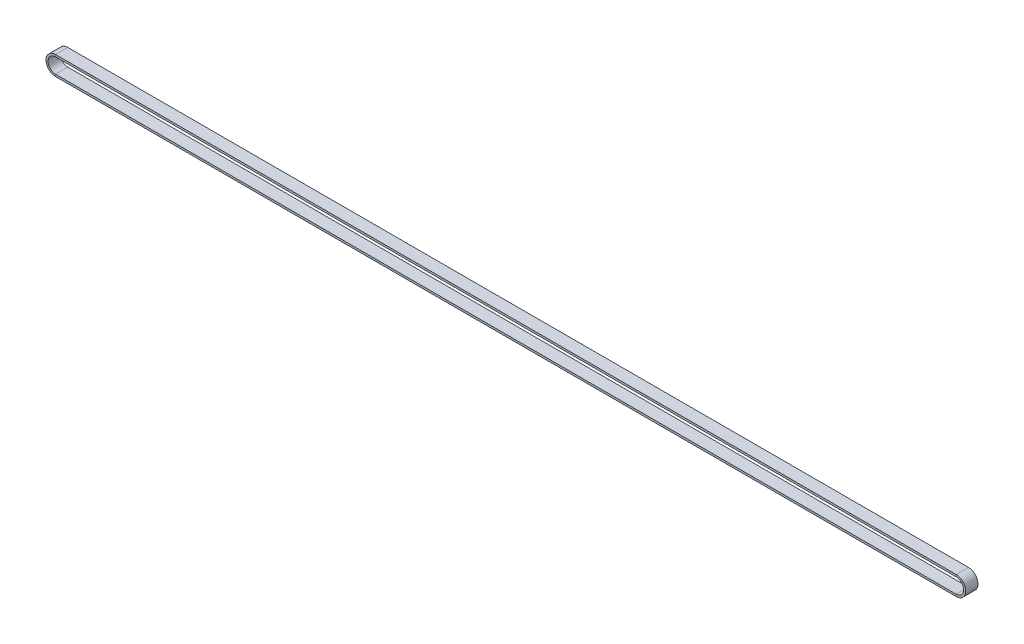
from build123d import *

# Parameters (mm, degrees)
SKETCH3_W = 9
SKETCH3_H = 1.5


with BuildPart() as part:
    # Sweep1: sweep along a path in Sketch2
    with BuildLine(Plane.XY) as sweep1_path:
        Line((0, -7), (-660.332653819, -7))
        ThreePointArc((-660.332653819, -7), (-667.332653819, 0), (-660.332653819, 7))
        Line((-660.332653819, 7), (0, 7))
        ThreePointArc((0, 7), (7, 0), (0, -7))
    # Sketch3 → Sweep1 (sweep)
    with BuildSketch(Plane(origin=(0, 0, 0), x_dir=(0, 0, -1), z_dir=(1, 0, 0))):
        with Locations((-4.5, 6.25)):
            Rectangle(SKETCH3_W, SKETCH3_H)
    sweep(path=sweep1_path.line)


solid = part.part
